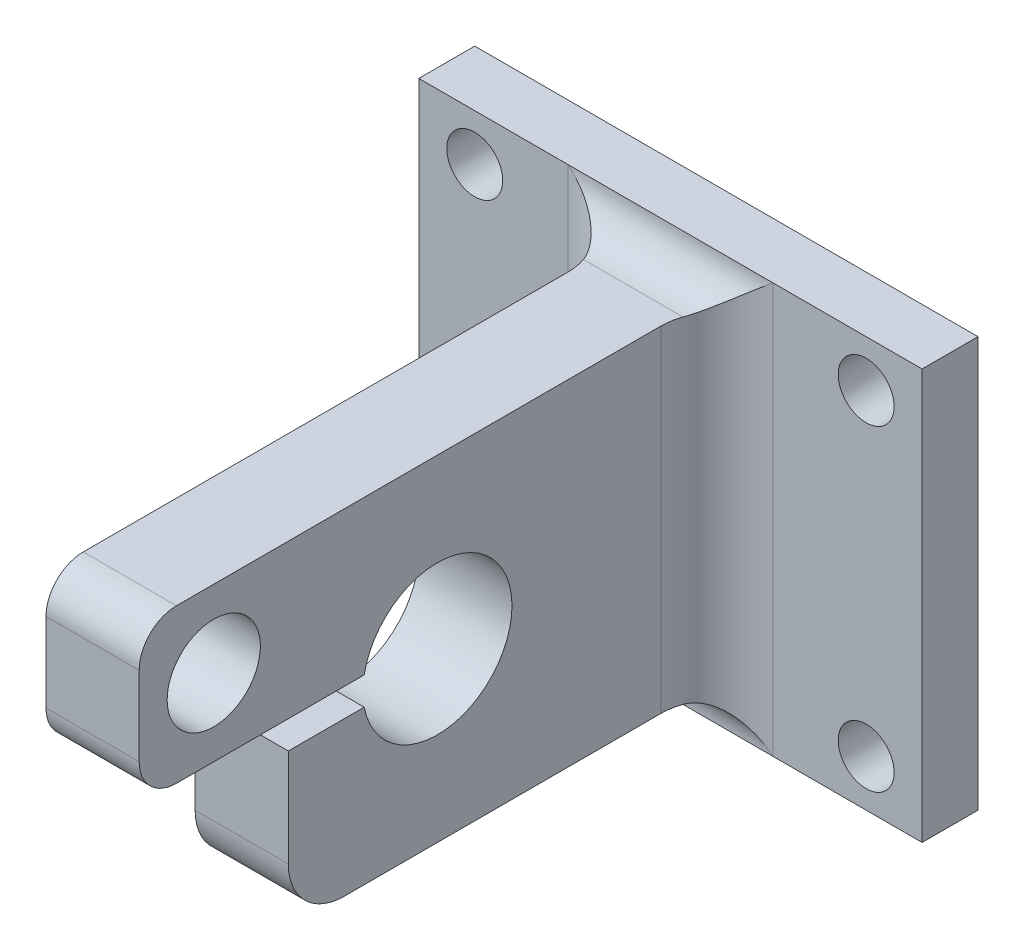
from build123d import *

# Parameters (mm, degrees)
SKETCH1_W               = 27
SKETCH1_H               = 22
SKETCH1_R               = 1.5
BOSS_EXTRUDE1_DEPTH     = 3
SKETCH2_W               = 5
SKETCH2_H               = 18
BOSS_EXTRUDE2_DEPTH     = 23
CUT_EXTRUDE1_DEPTH      = 33.449961479
CUT_EXTRUDE1_DEPTH_BACK = 33.449961479
SKETCH3_R               = 4
CUT_EXTRUDE2_DEPTH      = 33.449961479
CUT_EXTRUDE2_DEPTH_BACK = 33.449961479
SKETCH4_W               = 9.515030356
SKETCH4_H               = 1.5
FILLET1_R               = 3
FILLET2_R               = 2
FILLET3_R               = 3
SKETCH6_W               = 8
SKETCH6_H               = 8.25
SKETCH6_R               = 2.5
BOSS_EXTRUDE3_DEPTH     = 5
FILLET4_R               = 2


with BuildPart() as part:
    # Sketch1 → Boss-Extrude1 (new body)
    with BuildSketch(Plane.XY):
        Rectangle(SKETCH1_W, SKETCH1_H)
        with Locations((-10.5, -8.5)):
            Circle(SKETCH1_R, mode=Mode.SUBTRACT)
        with Locations((-10.5, 8.5)):
            Circle(SKETCH1_R, mode=Mode.SUBTRACT)
        with Locations((10.5, 8.5)):
            Circle(SKETCH1_R, mode=Mode.SUBTRACT)
        with Locations((10.5, -8.5)):
            Circle(SKETCH1_R, mode=Mode.SUBTRACT)
    extrude(amount=BOSS_EXTRUDE1_DEPTH)

    # Sketch2 → Boss-Extrude2 (add)
    with BuildSketch(Plane.XY.offset(3)):
        Rectangle(SKETCH2_W, SKETCH2_H)
    extrude(amount=BOSS_EXTRUDE2_DEPTH)

    # Sketch3 → Cut-Extrude1 (cut, two sides: drawn at the far end of the back side and taken through both)
    with BuildSketch(Plane(origin=(2.5, 0, 0), x_dir=(0, 0, -1), z_dir=(1, 0, 0)).offset(-CUT_EXTRUDE1_DEPTH_BACK)):
        with Locations(Location((-18, 0, 0), (0, 0, 180))):
            Circle(SKETCH3_R)
    extrude(amount=CUT_EXTRUDE1_DEPTH + CUT_EXTRUDE1_DEPTH_BACK, mode=Mode.SUBTRACT)

    # Sketch4 → Cut-Extrude2 (cut, two sides: drawn at the far end of the back side and taken through both)
    with BuildSketch(Plane(origin=(2.5, 0, 0), x_dir=(0, 0, -1), z_dir=(1, 0, 0)).offset(-CUT_EXTRUDE2_DEPTH_BACK)):
        with Locations((-21.491106051, 0)):
            Rectangle(SKETCH4_W, SKETCH4_H)
    extrude(amount=CUT_EXTRUDE2_DEPTH + CUT_EXTRUDE2_DEPTH_BACK, mode=Mode.SUBTRACT)

    # Fillet1
    fillet1_edges = [part.edges().sort_by_distance(p)[0] for p in [
        (-2.5, 0, 3),
        (2.5, 0, 3),
    ]]
    fillet(fillet1_edges, radius=FILLET1_R)

    # Fillet2
    fillet2_edges = [part.edges().sort_by_distance(p)[0] for p in [
        (0, -9, 3),
        (0, 9, 3),
    ]]
    fillet(fillet2_edges, radius=FILLET2_R - 0.0001)  # a hair under: the kernel refuses the full size

    # Fillet3
    fillet3_edges = [part.edges().sort_by_distance(p)[0] for p in [
        (0, -9, 26),
    ]]
    fillet(fillet3_edges, radius=FILLET3_R)

    # Sketch6 → Boss-Extrude3 (add)
    with BuildSketch(Plane.ZY.offset(2.5)):
        with Locations((30, 4.875)):
            Rectangle(SKETCH6_W, SKETCH6_H)
        with Locations((30, 4.875)):
            Circle(SKETCH6_R, mode=Mode.SUBTRACT)
    extrude(amount=-BOSS_EXTRUDE3_DEPTH)

    # Fillet4
    fillet4_edges = [part.edges().sort_by_distance(p)[0] for p in [
        (0, 0.75, 34),
        (0, 9, 34),
    ]]
    fillet(fillet4_edges, radius=FILLET4_R)


solid = part.part
